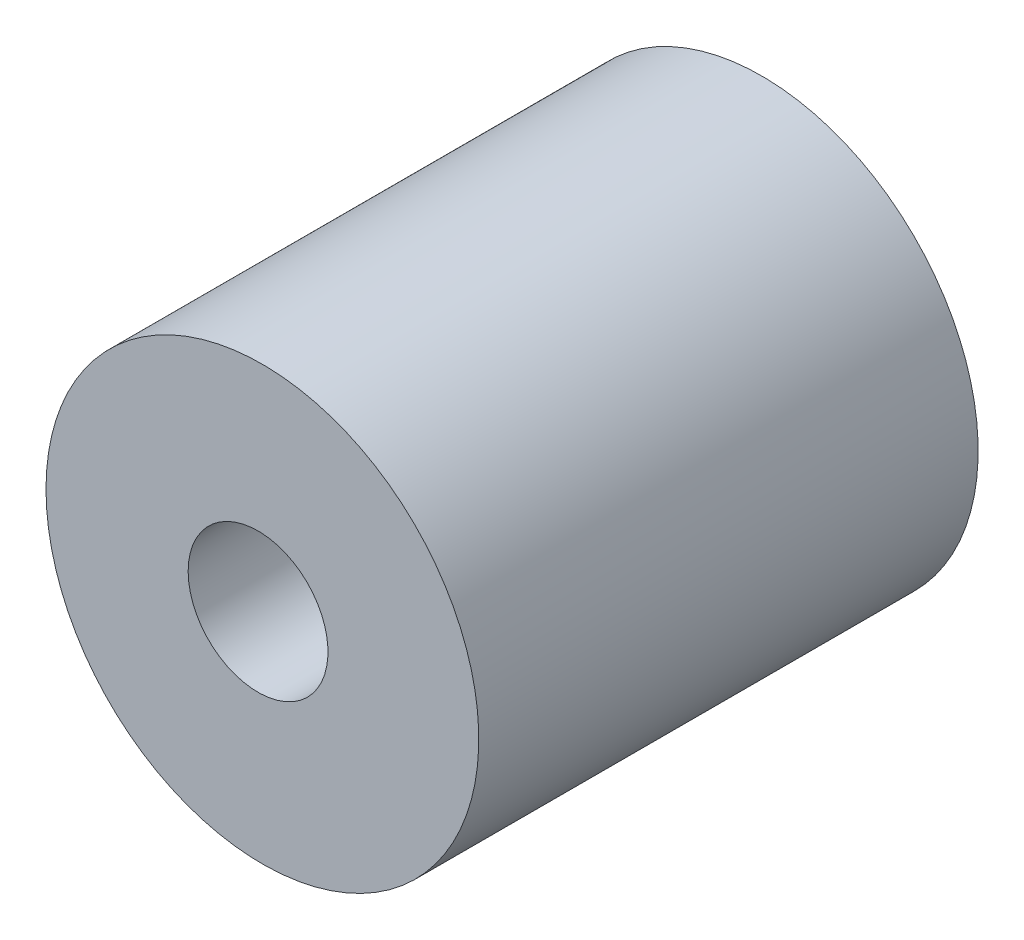
from build123d import *

# Parameters (mm, degrees)
SKETCH1_R           = 8.255
SKETCH1_R_2         = 2.667
BOSS_EXTRUDE1_DEPTH = 19.05


with BuildPart() as part:
    # Sketch1 → Boss-Extrude1 (new body)
    with BuildSketch(Plane.XY):
        with Locations((0.165429311, 0)):
            Circle(SKETCH1_R)
        Circle(SKETCH1_R_2, mode=Mode.SUBTRACT)
    extrude(amount=BOSS_EXTRUDE1_DEPTH)


solid = part.part
